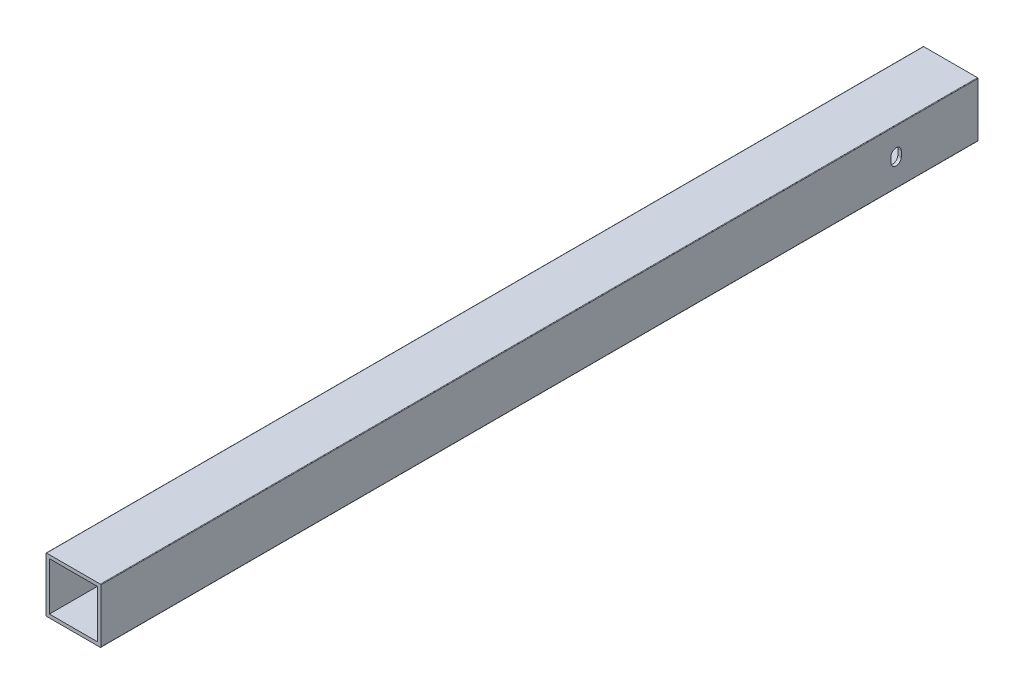
from build123d import *

# Parameters (mm, degrees)
SKETCH1_W           = 22.225
SKETCH1_H           = 22.225
BOSS_EXTRUDE1_DEPTH = 406.4
CUT_EXTRUDE2_DEPTH  = 408.888655341


with BuildPart() as part:
    # Sketch1 → Boss-Extrude1 (new body)
    with BuildSketch(Plane(origin=(0, 0, 0), x_dir=(-1, 0, 0), z_dir=(0, 0, -1))):
        with BuildLine():
            Line((1.5875, -1.3335), (1.5875, 23.5585))
            ThreePointArc((1.5875, 23.5585), (1.513105122, 23.738105122), (1.3335, 23.8125))
            Line((1.3335, 23.8125), (-23.5585, 23.8125))
            ThreePointArc((-23.5585, 23.8125), (-23.738105122, 23.738105122), (-23.8125, 23.5585))
            Line((-23.8125, 23.5585), (-23.8125, -1.3335))
            ThreePointArc((-23.8125, -1.3335), (-23.738105122, -1.513105122), (-23.5585, -1.5875))
            Line((-23.5585, -1.5875), (1.3335, -1.5875))
            ThreePointArc((1.3335, -1.5875), (1.513105122, -1.513105122), (1.5875, -1.3335))
        make_face()
        with Locations((-11.1125, 11.1125)):
            Rectangle(SKETCH1_W, SKETCH1_H, mode=Mode.SUBTRACT)
    extrude(amount=-BOSS_EXTRUDE1_DEPTH)

    # Sketch4 → Cut-Extrude2 (cut, through all)
    with BuildSketch(Plane(origin=(23.8125, 0, 0), x_dir=(0, 0, -1), z_dir=(1, 0, 0))):
        with BuildLine():
            ThreePointArc((-40.314518304, 9.8425), (-37.933268304, 7.46125), (-35.552018304, 9.8425))
            Line((-35.552018304, 9.8425), (-35.552018304, 12.3825))
            ThreePointArc((-35.552018304, 12.3825), (-37.933268304, 14.76375), (-40.314518304, 12.3825))
            Line((-40.314518304, 12.3825), (-40.314518304, 9.8425))
        make_face()
    extrude(amount=-CUT_EXTRUDE2_DEPTH, mode=Mode.SUBTRACT)


solid = part.part
